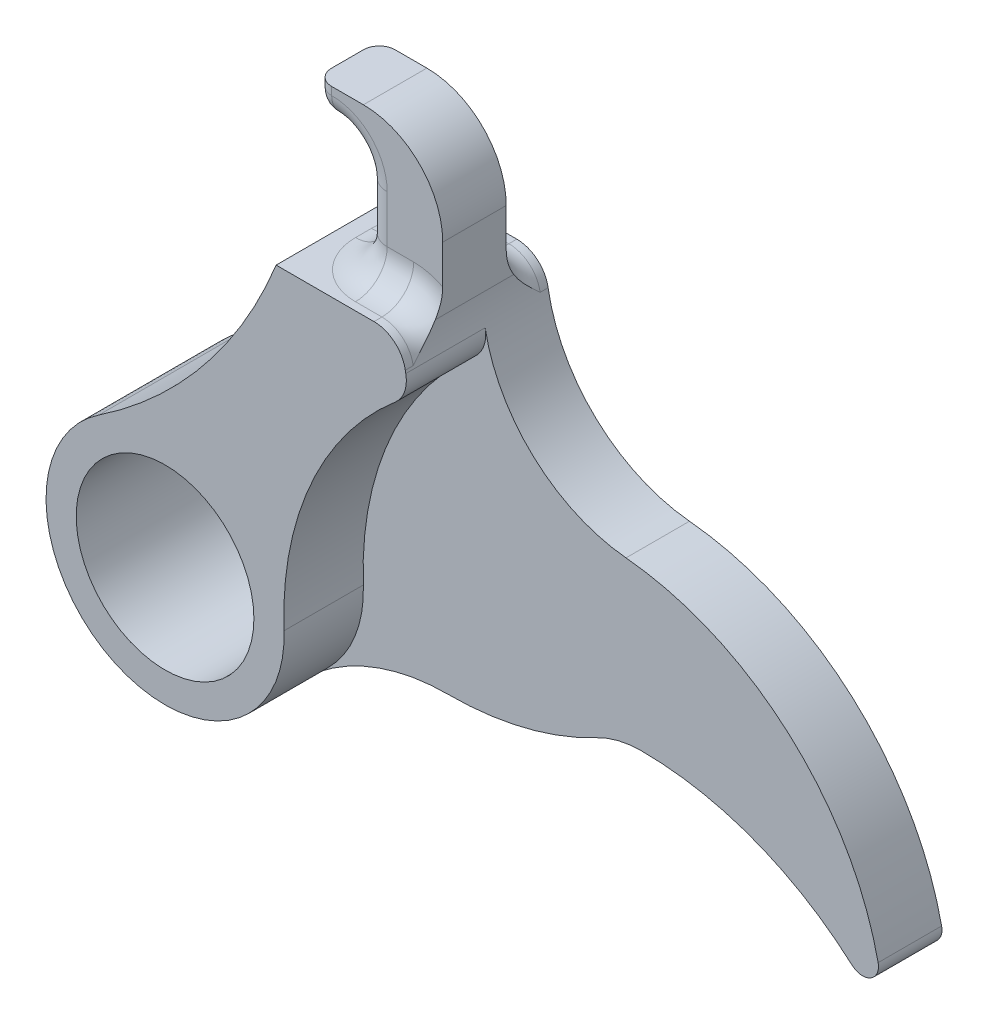
from build123d import *

# Parameters (mm, degrees)
EXTRUDE_1_DEPTH     = 9
CUT_EXTRUDE_START   = -5
CUT_EXTRUDE_1_DEPTH = 5
SKETCH_12_W         = 2.5
SKETCH_12_H         = 7
CUT_EXTRUDE_3_DEPTH = 42.911887352
FILLET_11_R         = 2
FILLET_1_R          = 1
SKETCH_10_W         = 8
SKETCH_10_H         = 4
EXTRUDE_3_DEPTH     = 2
FILLET_5_R          = 5
FILLET_10_R         = 7.5
FILLET_14_R         = 2
FILLET_15_R         = 1.5
FILLET_16_R         = 2
FILLET_17_R         = 1
FILLET_18_R         = 2
SKETCH_11_R         = 5.6
CUT_EXTRUDE_2_DEPTH = 44.514365603


# Some blends are built 0.0001 mm under size
with BuildPart() as part:
    # Эскиз2 → Бобышка-Вытянуть1 (new body)
    with BuildSketch(Plane.XY):
        with BuildLine():
            Line((-18, 0), (-15, 0))
            Line((-15, 0), (-15, 7))
            Line((-15, 7), (-10, 7))
            Line((-10, 7), (-10, 0))
            ThreePointArc((-10, 0), (-7.39984978, -6.726233956), (-0.951555354, -9.954624172))
            ThreePointArc((-0.951555354, -9.954624172), (10.407523967, -15.498539394), (15.320888862, -27.144247806))
            ThreePointArc((15.320888862, -27.144247806), (8.452365235, -21.873844259), (0, -20))
            ThreePointArc((0, -20), (-1.44344914, -20.176216472), (-2.802111775, -20.69451514))
            ThreePointArc((-2.802111775, -20.69451514), (-7.346697493, -22.426064476), (-12.174852362, -23.009539415))
            ThreePointArc((-12.174852362, -23.009539415), (-16.488233618, -23.738589268), (-20.315570084, -25.857142338))
            ThreePointArc((-20.315570084, -25.857142338), (-31.05163084, -24.430323259), (-29.168151763, -13.764896883))
            ThreePointArc((-29.168151763, -13.764896883), (-22.544234788, -7.726123715), (-18, 0))
        make_face()
    extrude(amount=EXTRUDE_1_DEPTH)

    # Эскиз6 → Вырез-Вытянуть1 (cut)
    with BuildSketch(Plane.XY.offset(9).offset(CUT_EXTRUDE_START)):
        with BuildLine():
            ThreePointArc((-9.55, -2.96605799), (-16.390256677, -12.316180922), (-16.898984287, -23.890078556))
            ThreePointArc((-16.898984287, -23.890078556), (-14.577958647, -23.229625817), (-12.174852362, -23.009539415))
            ThreePointArc((-12.174852362, -23.009539415), (-7.346697493, -22.426064476), (-2.802111775, -20.69451514))
            ThreePointArc((-2.802111775, -20.69451514), (-1.44344914, -20.176216472), (0, -20))
            ThreePointArc((0, -20), (8.452365235, -21.873844259), (15.320888862, -27.144247806))
            ThreePointArc((15.320888862, -27.144247806), (10.407523967, -15.498539394), (-0.951555354, -9.954624172))
            ThreePointArc((-0.951555354, -9.954624172), (-6.307192762, -7.760110789), (-9.55, -2.96605799))
        make_face()
    extrude(amount=CUT_EXTRUDE_1_DEPTH, mode=Mode.SUBTRACT)

    # Эскиз12 → Вырез-Вытянуть3 (cut, through all)
    with BuildSketch(Plane.ZY.offset(15)):
        with Locations((1.25, 3.5)):
            Rectangle(SKETCH_12_W, SKETCH_12_H)
        with Locations((7.75, 3.5)):
            Rectangle(SKETCH_12_W, SKETCH_12_H)
    extrude(amount=-CUT_EXTRUDE_3_DEPTH, mode=Mode.SUBTRACT)

    # Скругление11
    fillet_11_edges = [part.edges().sort_by_distance(p)[0] for p in [
        (-10, 0, 7.75),
        (-10, 0, 1.25),
    ]]
    fillet(fillet_11_edges, radius=FILLET_11_R)

    # Скругление1
    fillet_1_edges = [part.edges().sort_by_distance(p)[0] for p in [
        (15.320888862, -27.144247806, 2),
    ]]
    fillet(fillet_1_edges, radius=FILLET_1_R)

    # Эскиз10 → Бобышка-Вытянуть3 (add)
    with BuildSketch(Plane(origin=(0, 7, 0), x_dir=(-1, 0, 0), z_dir=(0, 1, 0))):
        with Locations((14, 4.5)):
            Rectangle(SKETCH_10_W, SKETCH_10_H)
    extrude(amount=EXTRUDE_3_DEPTH)

    # Скругление5
    fillet_5_edges = [part.edges().sort_by_distance(p)[0] for p in [
        (-10, 9, 4.5),
    ]]
    fillet(fillet_5_edges, radius=FILLET_5_R)

    # Скругление10
    fillet_10_edges = [part.edges().sort_by_distance(p)[0] for p in [
        (-16.898984287, -23.890078556, 6.5),
    ]]
    fillet(fillet_10_edges, radius=FILLET_10_R - 0.0001)  # a hair under: the kernel refuses the full size

    # Скругление14
    fillet_14_edges = [part.edges().sort_by_distance(p)[0] for p in [
        (-15, 7, 4.5),
    ]]
    fillet(fillet_14_edges, radius=FILLET_14_R)

    # Скругление15
    fillet_15_edges = [part.edges().sort_by_distance(p)[0] for p in [
        (-17.5, 7, 6.5),
        (-15, 2.5, 6.5),
        (-17.5, 7, 2.5),
        (-15.585786438, 6.414213562, 2.5),
        (-15.585786438, 6.414213562, 6.5),
        (-15, 2.5, 2.5),
    ]]
    fillet(fillet_15_edges, radius=FILLET_15_R)

    # Скругление16
    # the kernel refuses this fillet: 2 mm, written as the material it adds along each edge
    with BuildSketch(Plane(origin=(-11.832159566, -2, 6.5), x_dir=(-0.6907726827654878, -0.7230719886325089, 0), z_dir=(-0.7230719886325089, 0.6907726827654878, 0))) as fillet_16_piece_1_section:
        with BuildLine():
            CenterArc((2 + FILLET_16_R, FILLET_16_R), FILLET_16_R, 180, 90)
            Line((2, FILLET_16_R), (2, 0))
            Line((2, 0), (2 + FILLET_16_R, 0))
        make_face()
    fillet_16_piece_1 = revolve(axis=Axis((-11.832159566, -2, 6.5), (0, 0, 1)), revolution_arc=223.691304566, mode=Mode.PRIVATE)
    fillet_16_piece_1 = split(fillet_16_piece_1, bisect_by=Plane(origin=(-9.962064569, 0, 7.231915875), z_dir=(0, -1, 0)), keep=Keep.TOP, mode=Mode.PRIVATE)
    fillet_16_piece_1 = fillet_16_piece_1 - Plane(origin=(0, 0, 7.231915875), x_dir=(-1, 0, 0), z_dir=(0, 0, -1)) * Cylinder(10, 17, mode=Mode.PRIVATE)
    fillet_16_piece_1 = fillet_16_piece_1 - Plane(origin=(2.479707116, -18.943734501, 7.231915875), x_dir=(-0.6014853558135568, 0.7988838255602869, 0), z_dir=(0, 0, -1)) * Cylinder(20, 17, mode=Mode.PRIVATE)
    add(fillet_16_piece_1)
    with BuildSketch(Plane(origin=(-11.832159566, -2, 6.5), x_dir=(-0.6907726827654878, -0.7230719886325089, 0), z_dir=(-0.7230719886325089, 0.6907726827654878, 0))) as fillet_16_piece_2_section:
        with BuildLine():
            CenterArc((2 + FILLET_16_R, FILLET_16_R), FILLET_16_R, 180, 90)
            Line((2, FILLET_16_R), (2, 0))
            Line((2, 0), (2 + FILLET_16_R, 0))
        make_face()
    fillet_16_piece_2 = revolve(axis=Axis((-11.832159566, -2, 6.5), (0, 0, 1)), revolution_arc=223.691304566, mode=Mode.PRIVATE)
    fillet_16_piece_2 = split(fillet_16_piece_2, bisect_by=Plane(origin=(-11.088968436, 0, 6.841402023), z_dir=(0, 1, 0)), keep=Keep.TOP, mode=Mode.PRIVATE)
    fillet_16_piece_2 = split(fillet_16_piece_2, bisect_by=Plane(origin=(-10, 0.441530369, 6.841402023), z_dir=(-1, 0, 0)), keep=Keep.TOP, mode=Mode.PRIVATE)
    add(fillet_16_piece_2)
    with BuildSketch(Plane(origin=(-13.5, 0, 6.5), x_dir=(0, 0, 1), z_dir=(1, 0, 0))) as fillet_16_piece_3:
        with BuildLine():
            CenterArc((FILLET_16_R, -FILLET_16_R), FILLET_16_R, 90, 90)
            Line((0, -FILLET_16_R), (0, 0))
            Line((0, 0), (FILLET_16_R, 0))
        make_face()
    extrude(amount=1.667840434)
    with BuildSketch(Plane(origin=(-11.832159566, -2, 2.5), x_dir=(-0.6907726827654875, -0.7230719886325091, 0), z_dir=(-0.7230719886325091, 0.6907726827654875, 0))) as fillet_16_piece_4_section:
        with BuildLine():
            CenterArc((2 + FILLET_16_R, -FILLET_16_R), FILLET_16_R, 90, 90)
            Line((2, -FILLET_16_R), (2, 0))
            Line((2, 0), (2 + FILLET_16_R, 0))
        make_face()
    fillet_16_piece_4 = revolve(axis=Axis((-11.832159566, -2, 2.5), (0, 0, 1)), revolution_arc=223.691304566, mode=Mode.PRIVATE)
    fillet_16_piece_4 = split(fillet_16_piece_4, bisect_by=Plane(origin=(-9.962064569, 0, 1.768084125), z_dir=(0, -1, 0)), keep=Keep.TOP, mode=Mode.PRIVATE)
    fillet_16_piece_4 = fillet_16_piece_4 - Plane(origin=(0, 0, 1.768084125), x_dir=(-1, 0, 0), z_dir=(0, 0, -1)) * Cylinder(10, 17, mode=Mode.PRIVATE)
    add(fillet_16_piece_4)
    with BuildSketch(Plane(origin=(-11.832159566, -2, 2.5), x_dir=(-0.6907726827654875, -0.7230719886325091, 0), z_dir=(-0.7230719886325091, 0.6907726827654875, 0))) as fillet_16_piece_5_section:
        with BuildLine():
            CenterArc((2 + FILLET_16_R, -FILLET_16_R), FILLET_16_R, 90, 90)
            Line((2, -FILLET_16_R), (2, 0))
            Line((2, 0), (2 + FILLET_16_R, 0))
        make_face()
    fillet_16_piece_5 = revolve(axis=Axis((-11.832159566, -2, 2.5), (0, 0, 1)), revolution_arc=223.691304566, mode=Mode.PRIVATE)
    fillet_16_piece_5 = split(fillet_16_piece_5, bisect_by=Plane(origin=(-10, 0.441530341, 2.15859789), z_dir=(-1, 0, 0)), keep=Keep.TOP, mode=Mode.PRIVATE)
    add(fillet_16_piece_5)
    with BuildSketch(Plane(origin=(-13.5, 0, 2.5), x_dir=(0, 0, -1), z_dir=(1, 0, 0))) as fillet_16_piece_6:
        with BuildLine():
            CenterArc((FILLET_16_R, FILLET_16_R), FILLET_16_R, 180, 90)
            Line((0, FILLET_16_R), (0, 0))
            Line((0, 0), (FILLET_16_R, 0))
        make_face()
    extrude(amount=1.667840434)
    with BuildSketch(Plane(origin=(-13.5, 0, 4), x_dir=(0, 0, -1), z_dir=(1, 0, 0))) as fillet_16_piece_7:
        with BuildLine():
            CenterArc((1.5 + FILLET_16_R, FILLET_16_R), FILLET_16_R, 180, 90)
            Line((1.5 + FILLET_16_R, 0), (1.5, 0))
            Line((1.5, 0), (1.5, FILLET_16_R))
        make_face()
    revolve(axis=Axis((-13.5, 0, 4), (0, 1, 0)), revolution_arc=90)
    with BuildSketch(Plane(origin=(-15, 0, 4), x_dir=(0, 1, 0), z_dir=(0, 0, 1))) as fillet_16_piece_8:
        with BuildLine():
            CenterArc((FILLET_16_R, FILLET_16_R), FILLET_16_R, 180, 90)
            Line((0, FILLET_16_R), (0, 0))
            Line((0, 0), (FILLET_16_R, 0))
        make_face()
    extrude(amount=1)
    with BuildSketch(Plane(origin=(-13.5, 0, 5), x_dir=(0, 0, 1), z_dir=(1, 0, 0))) as fillet_16_piece_9:
        with BuildLine():
            CenterArc((1.5 + FILLET_16_R, -FILLET_16_R), FILLET_16_R, 90, 90)
            Line((1.5 + FILLET_16_R, 0), (1.5, 0))
            Line((1.5, 0), (1.5, -FILLET_16_R))
        make_face()
    revolve(axis=Axis((-13.5, 0, 5), (0, -1, 0)), revolution_arc=90)

    # Скругление17
    fillet_17_edges = [part.edges().sort_by_distance(p)[0] for p in [
        (-18, 8.75, 2.5),
        (-18, 7.439339828, 2.939339828),
        (-18, 7, 4.5),
        (-18, 8.75, 6.5),
        (-18, 7.439339828, 6.060660172),
    ]]
    fillet(fillet_17_edges, radius=FILLET_17_R - 0.0001)  # a hair under: the kernel refuses the full size

    # Скругление18
    fillet_18_edges = [part.edges().sort_by_distance(p)[0] for p in [
        (-9.55, -2.96605799, 5.25),
    ]]
    fillet(fillet_18_edges, radius=FILLET_18_R)

    # Эскиз11 → Вырез-Вытянуть2 (cut, through all)
    with BuildSketch(Plane.XY.offset(9)):
        with Locations((-25, -20)):
            Circle(SKETCH_11_R)
    extrude(amount=-CUT_EXTRUDE_2_DEPTH, mode=Mode.SUBTRACT)


solid = part.part
